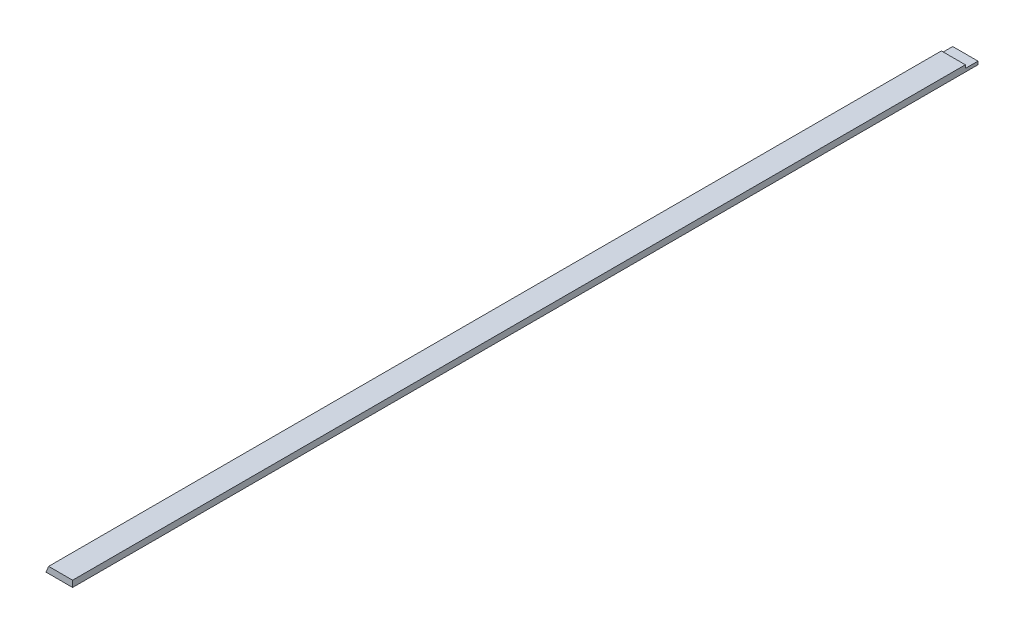
from build123d import *

# Parameters (mm, degrees)
BOSS_EXTRUDE1_DEPTH = 908.05
SKETCH2_W           = 26.67
SKETCH2_H           = 12.7
CUT_EXTRUDE1_DEPTH  = 3.175


with BuildPart() as part:
    # Sketch1 → Boss-Extrude1 (new body)
    with BuildSketch(Plane.XY):
        Polygon((0, 0), (26.67, 0), (26.67, 6.35), (2.630256121, 6.35), align=None)
    extrude(amount=BOSS_EXTRUDE1_DEPTH)

    # Sketch2 → Cut-Extrude1 (cut)
    with BuildSketch(Plane(origin=(0, 6.35, 0), x_dir=(1, 0, 0), z_dir=(0, 1, 0))):
        with Locations((13.335, -6.35)):
            Rectangle(SKETCH2_W, SKETCH2_H)
    extrude(amount=-CUT_EXTRUDE1_DEPTH, mode=Mode.SUBTRACT)


solid = part.part
